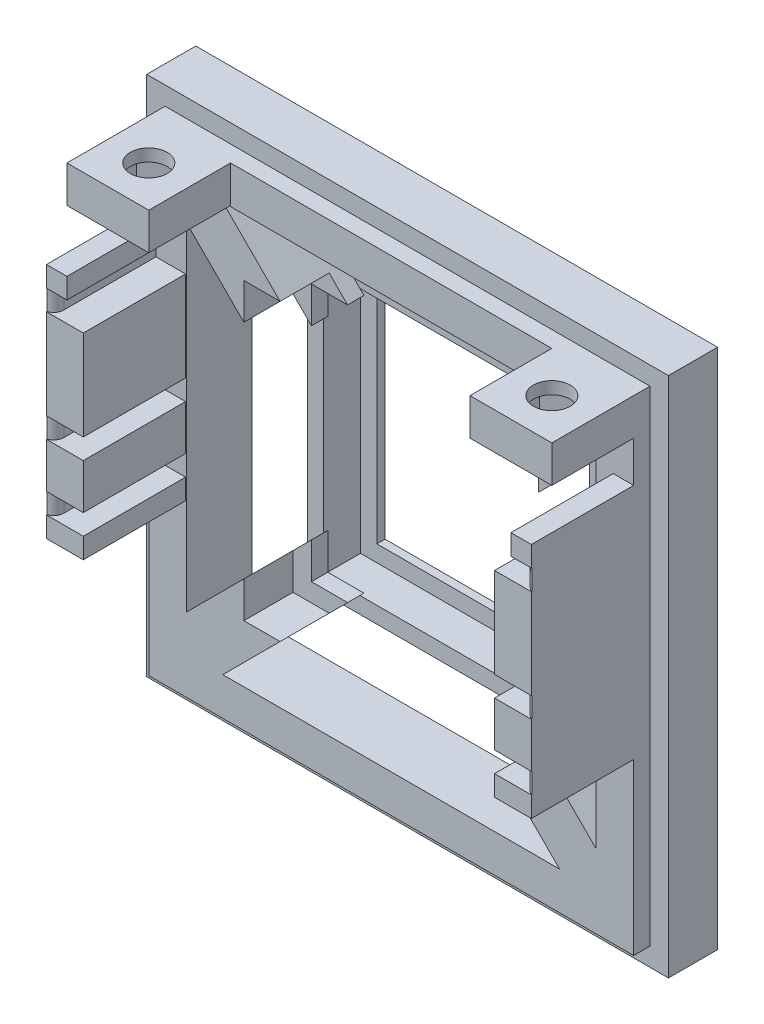
from build123d import *

# Parameters (mm, degrees)
ESBO_O3_W                = 47.4
ESBO_O3_H                = 47.4
RESSALTO_EXTRUS_O2_DEPTH = 1.6
ESBO_O5_W                = 51
ESBO_O5_H                = 51
RESSALTO_EXTRUS_O3_DEPTH = 1.6
CORTE_EXTRUS_O1_DEPTH    = 3.2
RESSALTO_EXTRUS_O4_DEPTH = 10
FILETE1_R                = 1
ESBO_O10_W               = 51
ESBO_O10_H               = 51
RESSALTO_EXTRUS_O5_DEPTH = 3.2
ESBO_O11_W               = 28.8
ESBO_O11_H               = 28.8
CORTE_EXTRUS_O2_DEPTH    = 4.8
ESBO_O14_W               = 25.2
ESBO_O14_H               = 25.2
CORTE_EXTRUS_O4_DEPTH    = 39.981277557
ESBO_O7_3_W              = 8
ESBO_O7_3_H              = 3.6
RESSALTO_EXTRUS_O7_DEPTH = 8
ESBO_O18_R               = 1.8
CORTE_EXTRUS_O8_DEPTH    = 2.4
ESBO_O18_3_R             = 1.8
CORTE_EXTRUS_O9_DEPTH    = 54.517940917
RESSALTO_EXTRUS_O8_DEPTH = 3.6
ESBO_O20_W               = 29.2
ESBO_O20_H               = 29.2
ESBO_O20_W_2             = 22.8
ESBO_O20_H_2             = 22.8
RESSALTO_EXTRUS_O9_DEPTH = 0.8
FILETE2_R                = 2


with BuildPart() as part:
    # Esboço3 → Ressalto-extrusão2 (new body)
    with BuildSketch(Plane.XY):
        Rectangle(ESBO_O3_W, ESBO_O3_H)
    extrude(amount=RESSALTO_EXTRUS_O2_DEPTH)

    # Esboço5 → Ressalto-extrusão3 (add)
    with BuildSketch(Plane(origin=(0, 0, 0), x_dir=(-1, 0, 0), z_dir=(0, 0, -1))):
        Rectangle(ESBO_O5_W, ESBO_O5_H)
    extrude(amount=RESSALTO_EXTRUS_O3_DEPTH)

    # Esboço6 → Corte-extrusão1 (cut)
    with BuildSketch(Plane(origin=(0, 0, -1.6), x_dir=(-1, 0, 0), z_dir=(0, 0, -1))):
        Polygon((3.535533906, 0), (20, 16.464466094), (20, -16.464466094), align=None)
        Polygon((-16.464466094, -20), (0, -3.535533906), (16.464466094, -20), align=None)
        Polygon((-20, 16.464466094), (-3.535533906, 0), (-20, -16.464466094), align=None)
        Polygon((-16.464466094, 20), (0, 3.535533906), (16.464466094, 20), align=None)
    extrude(amount=-CORTE_EXTRUS_O1_DEPTH, mode=Mode.SUBTRACT)

    # Esboço7 → Ressalto-extrusão4 (add)
    with BuildSketch(Plane.XY.offset(1.6)):
        Polygon((-21.7, 16.1), (-23.7, 16.1), (-23.7, -7.1), (-20.1, -7.1), (-20.1, -5.1), (-23, -5.1), (-23, -3.1), (-20.1, -3.1), (-20.1, 1.3), (-23, 1.3), (-23, 3.3), (-20.1, 3.3), (-20.1, 12.1), (-23, 12.1), (-23, 14.1), (-21.7, 14.1), align=None)
    ressalto_extrus_o4 = extrude(amount=RESSALTO_EXTRUS_O4_DEPTH)

    # Espelhar1: Ressalto-extrusão4 across plane
    add(ressalto_extrus_o4.mirror(Plane(origin=(0, 0, 0), x_dir=(0, 0, 1), z_dir=(1, 0, 0))))

    # Filete1
    # the kernel refuses this fillet: 1 mm, written as the material it takes off along each edge
    with BuildSketch(Plane(origin=(23, 12.1, 11.6), x_dir=(0, 0, -1), z_dir=(0, 1, 0)), Plane(origin=(23, 1.3, 11.6), x_dir=(0, 0, -1), z_dir=(0, 1, 0)), Plane(origin=(23, -5.1, 11.6), x_dir=(0, 0, -1), z_dir=(0, 1, 0)), Plane(origin=(-23, -5.1, 11.6), x_dir=(-1, 0, 0), z_dir=(0, 1, 0)), Plane(origin=(-23, 1.3, 11.6), x_dir=(-1, 0, 0), z_dir=(0, 1, 0)), Plane(origin=(-23, 12.1, 11.6), x_dir=(-1, 0, 0), z_dir=(0, 1, 0))) as filete1_piece_1:
        with BuildLine():
            CenterArc((FILETE1_R, -FILETE1_R), FILETE1_R, 90, 90)
            Line((0, -FILETE1_R), (0, 0))
            Line((0, 0), (FILETE1_R, 0))
        make_face()
    extrude(amount=2, mode=Mode.SUBTRACT)

    # Esboço10 → Ressalto-extrusão5 (add)
    with BuildSketch(Plane(origin=(0, 0, -1.6), x_dir=(-1, 0, 0), z_dir=(0, 0, -1))):
        Rectangle(ESBO_O10_W, ESBO_O10_H)
        Polygon((-16.464466094, -20), (16.464466094, -20), (0, -3.535533906), align=None, mode=Mode.SUBTRACT)
        Polygon((3.535533906, 0), (20, -16.464466094), (20, 16.464466094), align=None, mode=Mode.SUBTRACT)
        Polygon((0, 3.535533906), (16.464466094, 20), (-16.464466094, 20), align=None, mode=Mode.SUBTRACT)
        Polygon((-3.535533906, 0), (-20, 16.464466094), (-20, -16.464466094), align=None, mode=Mode.SUBTRACT)
    extrude(amount=RESSALTO_EXTRUS_O5_DEPTH)

    # Esboço11 → Corte-extrusão2 (cut)
    with BuildSketch(Plane.XY.offset(1.6)):
        Rectangle(ESBO_O11_W, ESBO_O11_H)
    extrude(amount=-CORTE_EXTRUS_O2_DEPTH, mode=Mode.SUBTRACT)

    # Esboço14 → Corte-extrusão4 (cut, through all)
    with BuildSketch(Plane.XY.offset(-3.2)):
        Rectangle(ESBO_O14_W, ESBO_O14_H)
    extrude(amount=-CORTE_EXTRUS_O4_DEPTH, mode=Mode.SUBTRACT)

    # Esboço7<3> → Ressalto-extrusão7 (add)
    with BuildSketch(Plane.XY.offset(1.6)):
        with Locations((-19.7, 21.9)):
            Rectangle(ESBO_O7_3_W, ESBO_O7_3_H)
    ressalto_extrus_o7 = extrude(amount=RESSALTO_EXTRUS_O7_DEPTH)

    # Espelhar2: Ressalto-extrusão7 across plane
    add(ressalto_extrus_o7.mirror(Plane(origin=(0, 0, 0), x_dir=(0, 0, 1), z_dir=(1, 0, 0))))

    # Esboço18 → Corte-extrusão8 (cut)
    # profile 1 of 2: a face of its own
    with BuildSketch(Plane.XZ.offset(-20.1)):
        Polygon((-16.9, 3.983419246), (-16.9, 7.216580754), (-19.7, 8.833161507), (-22.5, 7.216580754), (-22.5, 3.983419246), (-19.7, 2.366838493), align=None)
        with Locations(Location((-19.7, 5.6, 0), (0, 0, 270))):
            Circle(ESBO_O18_R, mode=Mode.SUBTRACT)
    # profile 2 of 2: a face of its own
    with BuildSketch(Plane.XZ.offset(-20.1)):
        Polygon((16.9, 7.216580754), (19.7, 8.833161507), (22.5, 7.216580754), (22.5, 3.983419246), (19.7, 2.366838493), (16.9, 3.983419246), align=None)
    extrude(amount=-CORTE_EXTRUS_O8_DEPTH, mode=Mode.SUBTRACT)

    # Esboço18<3> → Corte-extrusão9 (cut, through all)
    with BuildSketch(Plane.XZ.offset(-20.1)):
        with Locations((19.7, 5.6)):
            Circle(ESBO_O18_3_R)
        with Locations(Location((-19.7, 5.6, 0), (0, 0, 270))):
            Circle(ESBO_O18_3_R)
    extrude(amount=-CORTE_EXTRUS_O9_DEPTH, mode=Mode.SUBTRACT)


with BuildPart() as body_2:
    # Esboço19 → Ressalto-extrusão8 (new body)
    with BuildSketch(Plane(origin=(0, 0, -4.8), x_dir=(-1, 0, 0), z_dir=(0, 0, -1))):
        Polygon((-13, 9.464466094), (-13, 13), (-9.464466094, 13), (-11.064466094, 14.6), (-14.6, 14.6), (-14.6, 11.064466094), align=None)
        Polygon((-13, -9.464466094), (-13, 9.464466094), (-14.6, 11.064466094), (-14.6, -11.064466094), align=None)
        Polygon((-11.064466094, 14.6), (-9.464466094, 13), (9.464466094, 13), (11.064466094, 14.6), align=None)
        Polygon((11.064466094, 14.6), (9.464466094, 13), (13, 13), (13, 9.464466094), (14.6, 11.064466094), (14.6, 14.6), align=None)
        Polygon((14.6, 11.064466094), (13, 9.464466094), (13, -9.464466094), (14.6, -11.064466094), align=None)
        Polygon((13, -13), (9.464466094, -13), (11.064466094, -14.6), (14.6, -14.6), (14.6, -11.064466094), (13, -9.464466094), align=None)
        Polygon((9.464466094, -13), (-9.464466094, -13), (-11.064466094, -14.6), (11.064466094, -14.6), align=None)
        Polygon((-13, -13), (-13, -9.464466094), (-14.6, -11.064466094), (-14.6, -14.6), (-11.064466094, -14.6), (-9.464466094, -13), align=None)
    extrude(amount=RESSALTO_EXTRUS_O8_DEPTH)

    # Esboço20 → Ressalto-extrusão9 (add)
    with BuildSketch(Plane(origin=(0, 0, -8.4), x_dir=(-1, 0, 0), z_dir=(0, 0, -1))):
        Rectangle(ESBO_O20_W, ESBO_O20_H)
        Rectangle(ESBO_O20_W_2, ESBO_O20_H_2, mode=Mode.SUBTRACT)
    extrude(amount=RESSALTO_EXTRUS_O9_DEPTH)

    # Filete2
    filete2_edges = [body_2.edges().sort_by_distance(p)[0] for p in [
        (14.6, -14.6, -7),
        (14.6, 14.6, -7),
        (-14.6, 14.6, -7),
        (-14.6, -14.6, -7),
        (14.6, 0, -9.2),
        (0, -14.6, -9.2),
        (-14.6, 0, -9.2),
        (0, 14.6, -9.2),
    ]]
    fillet(filete2_edges, radius=FILETE2_R)


solid = Compound([part.part, body_2.part])
